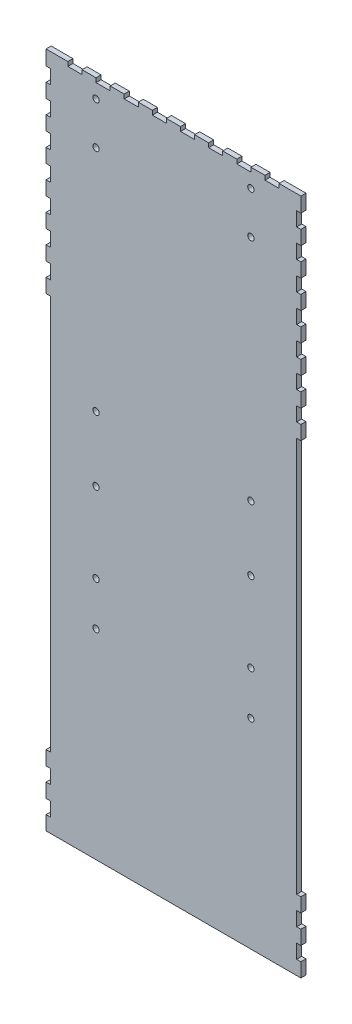
from build123d import *

# Parameters (mm, degrees)
BOSS_EXTRUDE1_DEPTH = 3.6
SKETCH3_R           = 2.25
CUT_EXTRUDE1_DEPTH  = 10


with BuildPart() as part:
    # Sketch1 → Boss-Extrude1 (new body)
    with BuildSketch(Plane.XY):
        Polygon((3, 408), (-12.5, 408), (-12.5, 405), (-22.5, 405), (-22.5, 408), (-32.5, 408), (-32.5, 405), (-42.5, 405), (-42.5, 408), (-52.5, 408), (-52.5, 405), (-62.5, 405), (-62.5, 408), (-72.5, 408), (-72.5, 405), (-82.5, 405), (-82.5, 408), (-92.5, 408), (-92.5, 405), (-102.5, 405), (-102.5, 408), (-112.5, 408), (-112.5, 405), (-122.5, 405), (-122.5, 408), (-132.5, 408), (-132.5, 405), (-142.5, 405), (-142.5, 408), (-152.5, 408), (-152.5, 405), (-162.5, 405), (-162.5, 408), (-178, 408), (-178, 397.5), (-175, 397.5), (-175, 387.5), (-178, 387.5), (-178, 377.5), (-175, 377.5), (-175, 367.5), (-178, 367.5), (-178, 357.5), (-175, 357.5), (-175, 347.5), (-178, 347.5), (-178, 337.5), (-175, 337.5), (-175, 327.5), (-178, 327.5), (-178, 317.5), (-175, 317.5), (-175, 307.5), (-178, 307.5), (-178, 297.5), (-175, 297.5), (-175, 287.5), (-178, 287.5), (-178, 277.5), (-175, 277.5), (-175, 267.5), (-178, 267.5), (-178, 257.5), (-175, 257.5), (-175, 0), (-175, -23), (-178, -23), (-178, -33), (-175, -33), (-175, -43), (-178, -43), (-178, -53), (-175, -53), (-175, -63), (-178, -63), (-178, -73), (3, -73), (3, -63), (0, -63), (0, -53), (3, -53), (3, -43), (0, -43), (0, -33), (3, -33), (3, -23), (0, -23), (0, 0), (0, 257.5), (3, 257.5), (3, 267.5), (0, 267.5), (0, 277.5), (3, 277.5), (3, 287.5), (0, 287.5), (0, 297.5), (3, 297.5), (3, 307.5), (0, 307.5), (0, 317.5), (3, 317.5), (3, 327.5), (0, 327.5), (0, 337.5), (3, 337.5), (3, 347.5), (0, 347.5), (0, 357.5), (3, 357.5), (3, 367.5), (0, 367.5), (0, 377.5), (3, 377.5), (3, 387.5), (0, 387.5), (0, 397.5), (3, 397.5), align=None)
    extrude(amount=BOSS_EXTRUDE1_DEPTH)

    # Sketch3 → Cut-Extrude1 (cut)
    with BuildSketch(Plane.XY.offset(3.6)):
        with Locations((-142.5, 365)):
            Circle(SKETCH3_R)
        with Locations((-32.5, 69.049357195)):
            Circle(SKETCH3_R)
        with Locations((-32.5, 100.049357195)):
            Circle(SKETCH3_R)
        with Locations((-142.5, 69.049357195)):
            Circle(SKETCH3_R)
        with Locations((-142.5, 100.049357195)):
            Circle(SKETCH3_R)
        with Locations((-142.5, 156.719761425)):
            Circle(SKETCH3_R)
        with Locations((-32.5, 156.719761425)):
            Circle(SKETCH3_R)
        with Locations((-32.5, 202.719761425)):
            Circle(SKETCH3_R)
        with Locations((-142.5, 202.719761425)):
            Circle(SKETCH3_R)
        with Locations((-32.5, 365)):
            Circle(SKETCH3_R)
        with Locations((-32.5, 395)):
            Circle(SKETCH3_R)
        with Locations((-142.5, 395)):
            Circle(SKETCH3_R)
    extrude(amount=-CUT_EXTRUDE1_DEPTH, mode=Mode.SUBTRACT)


solid = part.part
